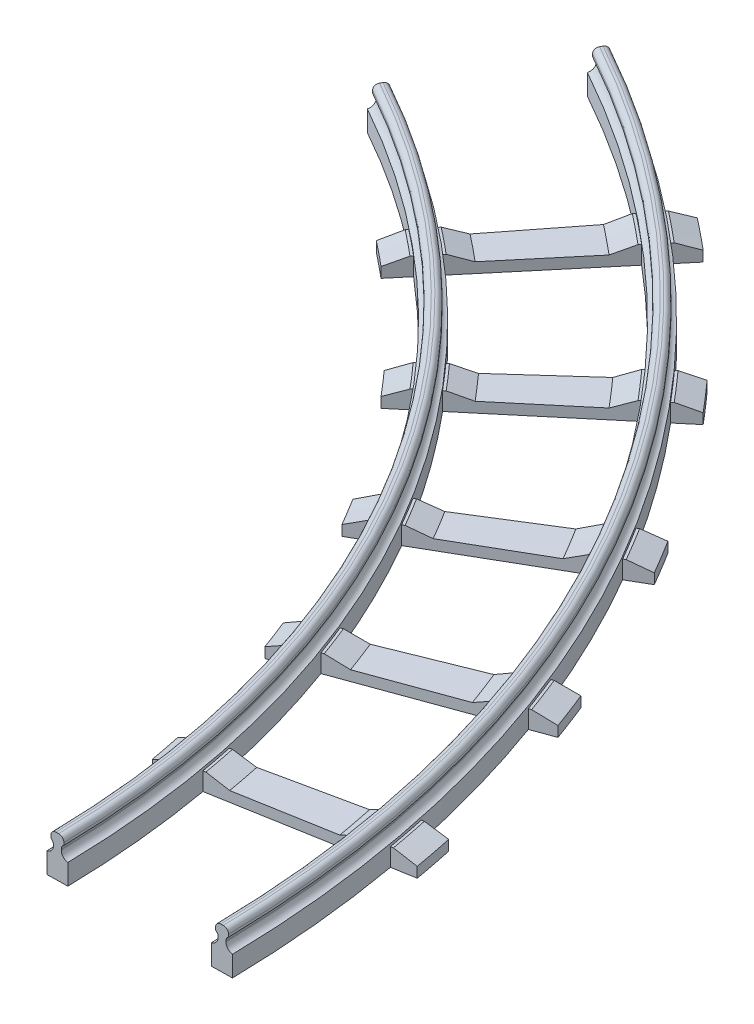
from build123d import *

# Parameters (mm, degrees)
SKETCH_1_W               = 4
SKETCH_1_H               = 21
SKETCH_1_H_2             = 8
EXTRUDE_1_DEPTH          = 4
SKETCH_1_7_W             = 44.5
SKETCH_1_7_H             = 8
EXTRUDE_2_DEPTH          = 3.5
SKETCH_2_W               = 18.5
SKETCH_2_H               = 1.5
CUT_EXTRUDE_1_DEPTH      = 37.7704025
SKETCH_2_3_W             = 2.5
SKETCH_2_3_H             = 1.5
EXTRUDE_4_DEPTH          = 29
FILLET_1_R               = 1
FILLET_2_R               = 1.5
FILLET_3_R               = 1
REVOLVE_2_ANGLE          = 62
CUT_EXTRUDE_5_DEPTH      = 224.885808369
REVOLVE_1_ANGLE          = 2
PATTERN_CIRCULAR_1_COUNT = 7
PATTERN_CIRCULAR_1_ANGLE = 60
CUT_REVOLVE_1_ANGLE      = 1
CUT_REVOLVE_2_ANGLE      = 1
CUT_REVOLVE_3_ANGLE      = 1
CUT_REVOLVE_4_ANGLE      = 1


with BuildPart() as part:
    # 草图1 → 凸台-拉伸1 (new body)
    with BuildSketch(Plane(origin=(0, 0, 0), x_dir=(1, 0, 0), z_dir=(0, 1, 0))):
        with Locations((-15.75, -4)):
            Rectangle(SKETCH_1_W, SKETCH_1_H)
        with Locations((15.75, -4)):
            Rectangle(SKETCH_1_W, SKETCH_1_H)
        with Locations((15.75, 10.5)):
            Rectangle(SKETCH_1_W, SKETCH_1_H_2)
        with Locations((-15.75, 10.5)):
            Rectangle(SKETCH_1_W, SKETCH_1_H_2)
    extrude(amount=EXTRUDE_1_DEPTH)

    # 草图1<7> → 凸台-拉伸2 (add)
    with BuildSketch(Plane(origin=(0, 0, 0), x_dir=(1, 0, 0), z_dir=(0, 1, 0))):
        with Locations((0, 10.5)):
            Rectangle(SKETCH_1_7_W, SKETCH_1_7_H)
    extrude(amount=EXTRUDE_2_DEPTH)

    # 草图2 → 切除-拉伸1 (cut, through all)
    with BuildSketch(Plane(origin=(0, 0, -14.5), x_dir=(-1, 0, 0), z_dir=(0, 0, -1))):
        with Locations((0, 2.75)):
            Rectangle(SKETCH_2_W, SKETCH_2_H)
        Polygon((13.25, 3.5), (9.25, 3.5), (9.25, 2), align=None)
        Polygon((-9.25, 3.5), (-13.25, 3.5), (-9.25, 2), align=None)
        Polygon((-22.25, 3.5), (-22.25, 2), (-18.25, 3.5), align=None)
        Polygon((22.25, 3.5), (18.25, 3.5), (22.25, 2), align=None)
    extrude(amount=-CUT_EXTRUDE_1_DEPTH, mode=Mode.SUBTRACT)

    # 草图2<3> → 凸台-拉伸4 (add, through all)
    with BuildSketch(Plane(origin=(0, 0, -14.5), x_dir=(-1, 0, 0), z_dir=(0, 0, -1))):
        with Locations((-15.75, 7.25)):
            Rectangle(SKETCH_2_3_W, SKETCH_2_3_H)
        Polygon((-15, 6.5), (-16.5, 6.5), (-16.5, 4), (-15.75, 4), (-15, 4), align=None)
        with Locations((15.75, 7.25)):
            Rectangle(SKETCH_2_3_W, SKETCH_2_3_H)
        Polygon((16.5, 6.5), (15, 6.5), (15, 4), (15.75, 4), (16.5, 4), align=None)
    extrude(amount=-EXTRUDE_4_DEPTH)

    # 圆角1
    # the kernel refuses this fillet: 1 mm, written as the material it adds along each edge
    with BuildSketch(Plane(origin=(-16.5, 6.5, -14.5), x_dir=(-1, 0, 0), z_dir=(0, 0, 1)), Plane(origin=(15, 6.5, -14.5), x_dir=(-1, 0, 0), z_dir=(0, 0, 1))) as fillet_1_piece_1:
        with BuildLine():
            CenterArc((1, 0.866025404), FILLET_1_R, 180, 60)
            Line((0, 0.866025404), (-0.02, 0.866025404))
            Line((-0.02, 0.866025404), (-0.02, 0))
            Line((-0.02, 0), (0, -0.02))
            ThreePointArc((0, -0.02), (0.25, -0.02), (0.49, -0.017320508))
            Line((0.49, -0.017320508), (0.5, 0))
        make_face()
    extrude(amount=29)
    with BuildSketch(Plane(origin=(-15, 6.5, -14.5), x_dir=(0, -1, 0), z_dir=(0, 0, 1)), Plane(origin=(16.5, 6.5, -14.5), x_dir=(0, -1, 0), z_dir=(0, 0, 1))) as fillet_1_piece_2:
        with BuildLine():
            CenterArc((0.866025404, 1), FILLET_1_R, 210, 60)
            Line((0, 0.5), (-0.017320508, 0.49))
            ThreePointArc((-0.017320508, 0.49), (-0.02, 0.25), (-0.02, 0))
            Line((-0.02, 0), (0, -0.02))
            Line((0, -0.02), (0.866025404, -0.02))
            Line((0.866025404, -0.02), (0.866025404, 0))
        make_face()
    extrude(amount=29)

    # 圆角2
    # the kernel refuses this fillet: 1.5 mm, written as the material it adds along each edge
    with BuildSketch(Plane(origin=(16.5, 4, -14.5), x_dir=(1, 0, 0), z_dir=(0, 0, 1))) as fillet_2_piece_1:
        with BuildLine():
            CenterArc((1.5, 1.479019946), FILLET_2_R, 180, 80.405931773)
            Line((0, 1.479019946), (-0.03, 1.479019946))
            Line((-0.03, 1.479019946), (-0.03, 0))
            Line((-0.03, 0), (0, -0.03))
            ThreePointArc((0, -0.03), (0.625, -0.03), (1.245, -0.029580399))
            Line((1.245, -0.029580399), (1.25, 0))
        make_face()
    extrude(amount=29)
    with BuildSketch(Plane(origin=(15, 4, -14.5), x_dir=(0, 1, 0), z_dir=(0, 0, 1)), Plane(origin=(-16.5, 4, -14.5), x_dir=(0, 1, 0), z_dir=(0, 0, 1))) as fillet_2_piece_2:
        with BuildLine():
            CenterArc((1.479019946, 1.5), FILLET_2_R, 189.594068227, 80.405931773)
            Line((0, 1.25), (-0.029580399, 1.245))
            ThreePointArc((-0.029580399, 1.245), (-0.03, 0.625), (-0.03, 0))
            Line((-0.03, 0), (0, -0.03))
            Line((0, -0.03), (1.479019946, -0.03))
            Line((1.479019946, -0.03), (1.479019946, 0))
        make_face()
    extrude(amount=29)
    with BuildSketch(Plane(origin=(-15, 4, -14.5), x_dir=(0, 1, 0), z_dir=(0, 0, 1))) as fillet_2_piece_3:
        with BuildLine():
            CenterArc((1.479019946, -1.5), FILLET_2_R, 90, 80.405931773)
            Line((0, -1.25), (-0.029580399, -1.245))
            ThreePointArc((-0.029580399, -1.245), (-0.03, -0.625), (-0.03, 0))
            Line((-0.03, 0), (0, 0.03))
            Line((0, 0.03), (1.479019946, 0.03))
            Line((1.479019946, 0.03), (1.479019946, 0))
        make_face()
    extrude(amount=29)

    # 圆角3
    fillet_3_edges = [part.edges().sort_by_distance(p)[0] for p in [
        (14.5, 8, 0),
        (17, 8, 0),
        (-17, 8, 0),
        (-14.5, 8, 0),
    ]]
    fillet(fillet_3_edges, radius=FILLET_3_R)

    # 草图7 → 旋转2 (revolve)
    with BuildSketch(Plane(origin=(0, 0, -14.5), x_dir=(-1, 0, 0), z_dir=(0, 0, -1))):
        with BuildLine():
            Line((-17.75, 3.5), (-17.75, 0))
            Line((-17.75, 0), (-13.75, 0))
            Line((-13.75, 0), (-13.75, 3.5))
            Line((-13.75, 3.5), (-13.75, 4))
            ThreePointArc((-13.75, 4), (-14.645643924, 4.510774109), (-15, 5.479019946))
            Line((-15, 5.479019946), (-15, 5.633974596))
            ThreePointArc((-15, 5.633974596), (-14.866025404, 6.133974596), (-14.5, 6.5))
            Line((-14.5, 6.5), (-14.5, 7))
            ThreePointArc((-14.5, 7), (-14.792893219, 7.707106781), (-15.5, 8))
            Line((-15.5, 8), (-16, 8))
            ThreePointArc((-16, 8), (-16.707106781, 7.707106781), (-17, 7))
            Line((-17, 7), (-17, 6.5))
            ThreePointArc((-17, 6.5), (-16.633974596, 6.133974596), (-16.5, 5.633974596))
            Line((-16.5, 5.633974596), (-16.5, 5.479019946))
            ThreePointArc((-16.5, 5.479019946), (-16.854356076, 4.510774109), (-17.75, 4))
            Line((-17.75, 4), (-17.75, 3.5))
        make_face()
        with BuildLine():
            Line((13.75, 3.5), (13.75, 0))
            Line((13.75, 0), (17.75, 0))
            Line((17.75, 0), (17.75, 3.5))
            Line((17.75, 3.5), (17.75, 4))
            ThreePointArc((17.75, 4), (16.854356076, 4.510774109), (16.5, 5.479019946))
            Line((16.5, 5.479019946), (16.5, 5.633974596))
            ThreePointArc((16.5, 5.633974596), (16.633974596, 6.133974596), (17, 6.5))
            Line((17, 6.5), (17, 7))
            ThreePointArc((17, 7), (16.707106781, 7.707106781), (16, 8))
            Line((16, 8), (15.5, 8))
            ThreePointArc((15.5, 8), (14.792893219, 7.707106781), (14.5, 7))
            Line((14.5, 7), (14.5, 6.5))
            ThreePointArc((14.5, 6.5), (14.866025404, 6.133974596), (15, 5.633974596))
            Line((15, 5.633974596), (15, 5.479019946))
            ThreePointArc((15, 5.479019946), (14.645643924, 4.510774109), (13.75, 4))
            Line((13.75, 4), (13.75, 3.5))
        make_face()
    revolve(axis=Axis((-200, 10, -14.5), (0, 1, 0)), revolution_arc=REVOLVE_2_ANGLE)

    # 草图5<2> → 切除-拉伸5 (cut, through all)
    with BuildSketch(Plane(origin=(0, 0, -14.5), x_dir=(-1, 0, 0), z_dir=(0, 0, -1))):
        with BuildLine():
            Line((17, 6.5), (17, 7))
            ThreePointArc((17, 7), (16.707106781, 7.707106781), (16, 8))
            Line((16, 8), (15.5, 8))
            ThreePointArc((15.5, 8), (14.792893219, 7.707106781), (14.5, 7))
            Line((14.5, 7), (14.5, 6.5))
            ThreePointArc((14.5, 6.5), (14.866025404, 6.133974596), (15, 5.633974596))
            Line((15, 5.633974596), (15, 5.479019946))
            ThreePointArc((15, 5.479019946), (14.645643924, 4.510774109), (13.75, 4))
            Line((13.75, 4), (13.75, 3.5))
            Line((13.75, 3.5), (13.25, 3.5))
            Line((13.25, 3.5), (9.25, 2))
            Line((9.25, 2), (-9.25, 2))
            Line((-9.25, 2), (-13.25, 3.5))
            Line((-13.25, 3.5), (-13.75, 3.5))
            Line((-13.75, 3.5), (-13.75, 4))
            ThreePointArc((-13.75, 4), (-14.645643924, 4.510774109), (-15, 5.479019946))
            Line((-15, 5.479019946), (-15, 5.633974596))
            ThreePointArc((-15, 5.633974596), (-14.866025404, 6.133974596), (-14.5, 6.5))
            Line((-14.5, 6.5), (-14.5, 7))
            ThreePointArc((-14.5, 7), (-14.792893219, 7.707106781), (-15.5, 8))
            Line((-15.5, 8), (-16, 8))
            ThreePointArc((-16, 8), (-16.707106781, 7.707106781), (-17, 7))
            Line((-17, 7), (-17, 6.5))
            ThreePointArc((-17, 6.5), (-16.633974596, 6.133974596), (-16.5, 5.633974596))
            Line((-16.5, 5.633974596), (-16.5, 5.479019946))
            ThreePointArc((-16.5, 5.479019946), (-16.854356076, 4.510774109), (-17.75, 4))
            Line((-17.75, 4), (-17.75, 3.5))
            Line((-17.75, 3.5), (-18.25, 3.5))
            Line((-18.25, 3.5), (-22.25, 2))
            Line((-22.25, 2), (-22.25, 0))
            Line((-22.25, 0), (22.25, 0))
            Line((22.25, 0), (22.25, 2))
            Line((22.25, 2), (18.25, 3.5))
            Line((18.25, 3.5), (17.75, 3.5))
            Line((17.75, 3.5), (17.75, 4))
            ThreePointArc((17.75, 4), (16.854356076, 4.510774109), (16.5, 5.479019946))
            Line((16.5, 5.479019946), (16.5, 5.633974596))
            ThreePointArc((16.5, 5.633974596), (16.633974596, 6.133974596), (17, 6.5))
        make_face()
    extrude(amount=-CUT_EXTRUDE_5_DEPTH, mode=Mode.SUBTRACT)


with BuildPart() as cut_extrude_5_piece_1:
    # of the separate pieces the step leaves, piece 1, a body of its own (cut_extrude_5_pieces)
    add(part.part.solids().sort_by_distance((13.75, 0, -14.5))[0])



with BuildPart() as cut_extrude_5_piece_2:
    # of the separate pieces the step leaves, piece 2, a body of its own (cut_extrude_5_pieces)
    add(part.part.solids().sort_by_distance((-13.75, 4, -14.5))[0])


with BuildPart() as cut_extrude_5_piece_1_1:
    add(cut_extrude_5_piece_1.part)

    add(cut_extrude_5_piece_2.part)  # 旋转1 merges 切除-拉伸5 piece 2
    # 草图5 → 旋转1 (revolve)
    with BuildSketch(Plane(origin=(0, 0, -14.5), x_dir=(-1, 0, 0), z_dir=(0, 0, -1))):
        with BuildLine():
            Line((17, 6.5), (17, 7))
            ThreePointArc((17, 7), (16.707106781, 7.707106781), (16, 8))
            Line((16, 8), (15.5, 8))
            ThreePointArc((15.5, 8), (14.792893219, 7.707106781), (14.5, 7))
            Line((14.5, 7), (14.5, 6.5))
            ThreePointArc((14.5, 6.5), (14.866025404, 6.133974596), (15, 5.633974596))
            Line((15, 5.633974596), (15, 5.479019946))
            ThreePointArc((15, 5.479019946), (14.645643924, 4.510774109), (13.75, 4))
            Line((13.75, 4), (13.75, 3.5))
            Line((13.75, 3.5), (13.25, 3.5))
            Line((13.25, 3.5), (9.25, 2))
            Line((9.25, 2), (-9.25, 2))
            Line((-9.25, 2), (-13.25, 3.5))
            Line((-13.25, 3.5), (-13.75, 3.5))
            Line((-13.75, 3.5), (-13.75, 4))
            ThreePointArc((-13.75, 4), (-14.645643924, 4.510774109), (-15, 5.479019946))
            Line((-15, 5.479019946), (-15, 5.633974596))
            ThreePointArc((-15, 5.633974596), (-14.866025404, 6.133974596), (-14.5, 6.5))
            Line((-14.5, 6.5), (-14.5, 7))
            ThreePointArc((-14.5, 7), (-14.792893219, 7.707106781), (-15.5, 8))
            Line((-15.5, 8), (-16, 8))
            ThreePointArc((-16, 8), (-16.707106781, 7.707106781), (-17, 7))
            Line((-17, 7), (-17, 6.5))
            ThreePointArc((-17, 6.5), (-16.633974596, 6.133974596), (-16.5, 5.633974596))
            Line((-16.5, 5.633974596), (-16.5, 5.479019946))
            ThreePointArc((-16.5, 5.479019946), (-16.854356076, 4.510774109), (-17.75, 4))
            Line((-17.75, 4), (-17.75, 3.5))
            Line((-17.75, 3.5), (-18.25, 3.5))
            Line((-18.25, 3.5), (-22.25, 2))
            Line((-22.25, 2), (-22.25, 0))
            Line((-22.25, 0), (22.25, 0))
            Line((22.25, 0), (22.25, 2))
            Line((22.25, 2), (18.25, 3.5))
            Line((18.25, 3.5), (17.75, 3.5))
            Line((17.75, 3.5), (17.75, 4))
            ThreePointArc((17.75, 4), (16.854356076, 4.510774109), (16.5, 5.479019946))
            Line((16.5, 5.479019946), (16.5, 5.633974596))
            ThreePointArc((16.5, 5.633974596), (16.633974596, 6.133974596), (17, 6.5))
        make_face()
    revolve_1 = revolve(axis=Axis((-200, 10, -14.5), (0, 1, 0)), revolution_arc=REVOLVE_1_ANGLE)

    # 阵列(圆周)1: 旋转1 ×7 about axis
    pattern_circular_1_axis = Axis((-200, 0, -14.5), (0, 1, 0))
    for i in range(1, PATTERN_CIRCULAR_1_COUNT):
        add(revolve_1.rotate(pattern_circular_1_axis, i * PATTERN_CIRCULAR_1_ANGLE / (PATTERN_CIRCULAR_1_COUNT - 1)))

    # 草图8 → 切除-旋转1 (revolve, cut)
    with BuildSketch(Plane.XY.offset(-14.5)):
        with BuildLine():
            Line((-22.25, 2), (-22.25, 0))
            Line((-22.25, 0), (22.25, 0))
            Line((22.25, 0), (22.25, 2))
            Line((22.25, 2), (18.25, 3.5))
            Line((18.25, 3.5), (17.75, 3.5))
            Line((17.75, 3.5), (17.75, 4))
            ThreePointArc((17.75, 4), (16.854356076, 4.510774109), (16.5, 5.479019946))
            Line((16.5, 5.479019946), (16.5, 5.633974596))
            ThreePointArc((16.5, 5.633974596), (16.633974596, 6.133974596), (17, 6.5))
            Line((17, 6.5), (17, 7))
            ThreePointArc((17, 7), (16.707106781, 7.707106781), (16, 8))
            Line((16, 8), (15.5, 8))
            ThreePointArc((15.5, 8), (14.792893219, 7.707106781), (14.5, 7))
            Line((14.5, 7), (14.5, 6.5))
            ThreePointArc((14.5, 6.5), (14.866025404, 6.133974596), (15, 5.633974596))
            Line((15, 5.633974596), (15, 5.479019946))
            ThreePointArc((15, 5.479019946), (14.645643924, 4.510774109), (13.75, 4))
            Line((13.75, 4), (13.75, 3.5))
            Line((13.75, 3.5), (13.25, 3.5))
            Line((13.25, 3.5), (9.25, 2))
            Line((9.25, 2), (-9.25, 2))
            Line((-9.25, 2), (-13.25, 3.5))
            Line((-13.25, 3.5), (-13.75, 3.5))
            Line((-13.75, 3.5), (-13.75, 4))
            ThreePointArc((-13.75, 4), (-14.645643924, 4.510774109), (-15, 5.479019946))
            Line((-15, 5.479019946), (-15, 5.633974596))
            ThreePointArc((-15, 5.633974596), (-14.866025404, 6.133974596), (-14.5, 6.5))
            Line((-14.5, 6.5), (-14.5, 7))
            ThreePointArc((-14.5, 7), (-14.792893219, 7.707106781), (-15.5, 8))
            Line((-15.5, 8), (-16, 8))
            ThreePointArc((-16, 8), (-16.707106781, 7.707106781), (-17, 7))
            Line((-17, 7), (-17, 6.5))
            ThreePointArc((-17, 6.5), (-16.633974596, 6.133974596), (-16.5, 5.633974596))
            Line((-16.5, 5.633974596), (-16.5, 5.479019946))
            ThreePointArc((-16.5, 5.479019946), (-16.854356076, 4.510774109), (-17.75, 4))
            Line((-17.75, 4), (-17.75, 3.5))
            Line((-17.75, 3.5), (-18.25, 3.5))
            Line((-18.25, 3.5), (-22.25, 2))
        make_face()
    revolve(axis=Axis((-200, 10, -14.5), (0, 1, 0)), revolution_arc=CUT_REVOLVE_1_ANGLE, mode=Mode.SUBTRACT)

    # 草图9 → 切除-旋转2 (revolve, cut)
    with BuildSketch(Plane(origin=(-161.929812748, 0, -86.099608705), x_dir=(-0.46947156278588864, 0, 0.8829475928589281), z_dir=(-0.8829475928589281, 0, -0.46947156278588864))):
        with BuildLine():
            Line((-141.158427539, 0), (-96.658427539, 0))
            Line((-96.658427539, 0), (-96.658427539, 2))
            Line((-96.658427539, 2), (-100.658427539, 3.5))
            Line((-100.658427539, 3.5), (-101.158427539, 3.5))
            Line((-101.158427539, 3.5), (-101.158427539, 4))
            ThreePointArc((-101.158427539, 4), (-102.054071463, 4.510774109), (-102.408427539, 5.479019946))
            Line((-102.408427539, 5.479019946), (-102.408427539, 5.633974596))
            ThreePointArc((-102.408427539, 5.633974596), (-102.274452943, 6.133974596), (-101.908427539, 6.5))
            Line((-101.908427539, 6.5), (-101.908427539, 7))
            ThreePointArc((-101.908427539, 7), (-102.201320758, 7.707106781), (-102.908427539, 8))
            Line((-102.908427539, 8), (-103.408427539, 8))
            ThreePointArc((-103.408427539, 8), (-104.11553432, 7.707106781), (-104.408427539, 7))
            Line((-104.408427539, 7), (-104.408427539, 6.5))
            ThreePointArc((-104.408427539, 6.5), (-104.042402135, 6.133974596), (-103.908427539, 5.633974596))
            Line((-103.908427539, 5.633974596), (-103.908427539, 5.479019946))
            ThreePointArc((-103.908427539, 5.479019946), (-104.262783616, 4.510774109), (-105.158427539, 4))
            Line((-105.158427539, 4), (-105.158427539, 3.5))
            Line((-105.158427539, 3.5), (-105.658427539, 3.5))
            Line((-105.658427539, 3.5), (-109.658427539, 2))
            Line((-109.658427539, 2), (-128.158427539, 2))
            Line((-128.158427539, 2), (-132.158427539, 3.5))
            Line((-132.158427539, 3.5), (-132.658427539, 3.5))
            Line((-132.658427539, 3.5), (-132.658427539, 4))
            ThreePointArc((-132.658427539, 4), (-133.554071463, 4.510774109), (-133.908427539, 5.479019946))
            Line((-133.908427539, 5.479019946), (-133.908427539, 5.633974596))
            ThreePointArc((-133.908427539, 5.633974596), (-133.774452943, 6.133974596), (-133.408427539, 6.5))
            Line((-133.408427539, 6.5), (-133.408427539, 7))
            ThreePointArc((-133.408427539, 7), (-133.701320758, 7.707106781), (-134.408427539, 8))
            Line((-134.408427539, 8), (-134.908427539, 8))
            ThreePointArc((-134.908427539, 8), (-135.61553432, 7.707106781), (-135.908427539, 7))
            Line((-135.908427539, 7), (-135.908427539, 6.5))
            ThreePointArc((-135.908427539, 6.5), (-135.542402135, 6.133974596), (-135.408427539, 5.633974596))
            Line((-135.408427539, 5.633974596), (-135.408427539, 5.479019946))
            ThreePointArc((-135.408427539, 5.479019946), (-135.762783616, 4.510774109), (-136.658427539, 4))
            Line((-136.658427539, 4), (-136.658427539, 3.5))
            Line((-136.658427539, 3.5), (-137.158427539, 3.5))
            Line((-137.158427539, 3.5), (-141.158427539, 2))
            Line((-141.158427539, 2), (-141.158427539, 0))
        make_face()
    revolve(axis=Axis((-200, 10, -14.5), (0, -1, 0)), revolution_arc=CUT_REVOLVE_2_ANGLE, mode=Mode.SUBTRACT)

    # 草图10 → 切除-旋转3 (revolve, cut)
    with BuildSketch(Plane(origin=(-0.313938649, 0, -17.985533166), x_dir=(0.9998476951563913, 0, -0.01745240643728355), z_dir=(0.01745240643728355, 0, 0.9998476951563913))):
        Polygon((-17.466479138, 3.5), (-17.466479138, 0), (-21.966479138, 0), (-21.966479138, 2), (-17.966479138, 3.5), align=None)
        Polygon((-13.466479138, 3.5), (-13.466479138, 0), (14.033520862, 0), (14.033520862, 3.5), (13.533520862, 3.5), (9.533520862, 2), (-8.966479138, 2), (-12.966479138, 3.5), align=None)
        Polygon((18.033520862, 3.5), (18.033520862, 0), (22.533520862, 0), (22.533520862, 2), (18.533520862, 3.5), align=None)
    revolve(axis=Axis((-200, 10, -14.5), (0, 1, 0)), revolution_arc=CUT_REVOLVE_3_ANGLE, mode=Mode.SUBTRACT)

    # 草图11 → 切除-旋转4 (revolve, cut)
    with BuildSketch(Plane(origin=(-159.14027512, 0, -88.21289495), x_dir=(-0.484809620246335, 0, 0.8746197071393971), z_dir=(-0.8746197071393971, 0, -0.484809620246335))):
        Polygon((-133.470061704, 0), (-133.470061704, 3.5), (-133.970061704, 3.5), (-137.970061704, 2), (-137.970061704, 0), align=None)
        Polygon((-129.470061704, 3.5), (-129.470061704, 0), (-101.970061704, 0), (-101.970061704, 3.5), (-102.470061704, 3.5), (-106.470061704, 2), (-124.970061704, 2), (-128.970061704, 3.5), align=None)
        Polygon((-97.970061704, 3.5), (-97.970061704, 0), (-93.470061704, 0), (-93.470061704, 2), (-97.470061704, 3.5), align=None)
    revolve(axis=Axis((-200, 10, -14.5), (0, -1, 0)), revolution_arc=CUT_REVOLVE_4_ANGLE, mode=Mode.SUBTRACT)


solid = cut_extrude_5_piece_1_1.part
